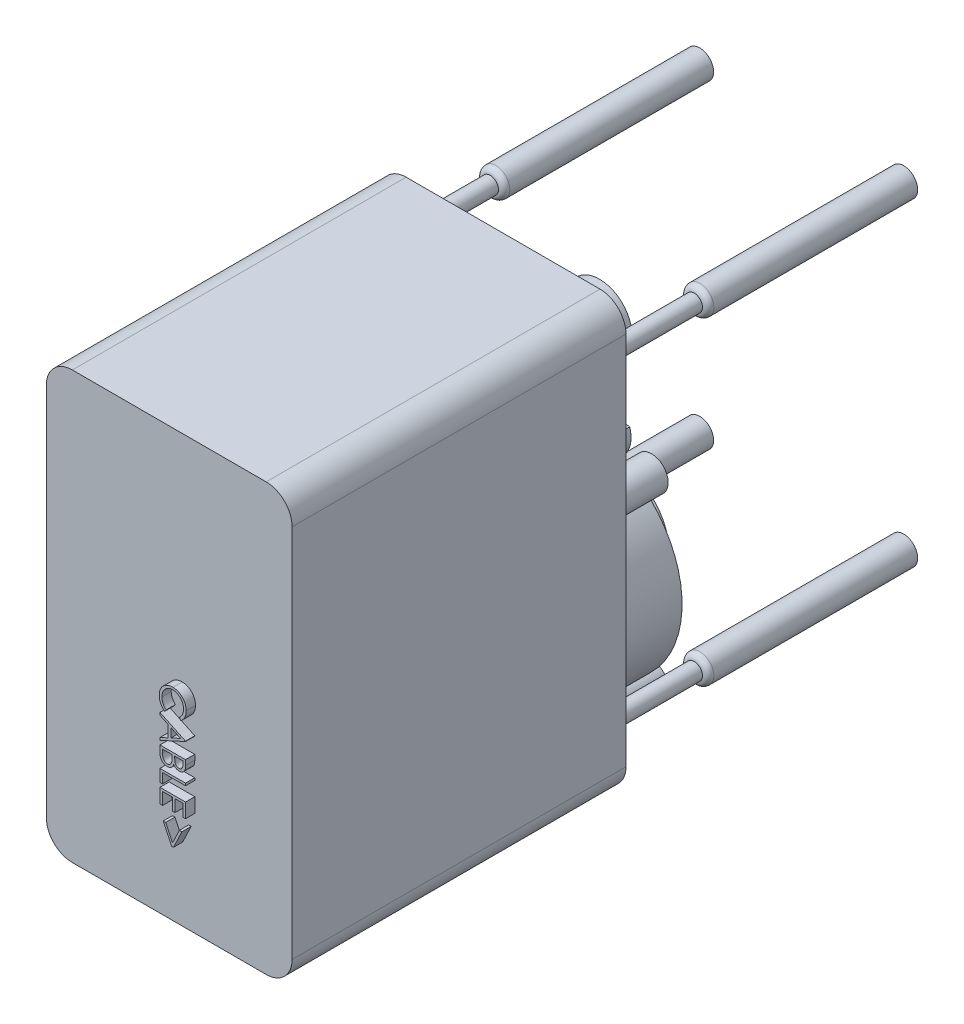
from build123d import *
from build123d.topology import SkipClean

# Parameters (mm, degrees)
SKETCH1_R                = 7.239
BOSS_EXTRUDE1_DEPTH      = 10.16
SKETCH2_R                = 6.35
BOSS_EXTRUDE2_DEPTH      = 1.778
SKETCH3_R                = 2.286
BOSS_EXTRUDE3_DEPTH      = 1.27
BOSS_EXTRUDE4_DEPTH      = 3.556
SKETCH5_R                = 4.445
BOSS_EXTRUDE5_DEPTH      = 11.43
SKETCH6_R                = 1.143
BOSS_EXTRUDE6_DEPTH      = 15.494
BOSS_EXTRUDE6_2_DEPTH    = 15.494
BOSS_EXTRUDE6_3_DEPTH    = 15.494
BOSS_EXTRUDE6_4_DEPTH    = 15.494
SKETCH7_R                = 7.239
BOSS_EXTRUDE7_DEPTH      = 5.334
BOSS_EXTRUDE8_DEPTH      = 45.72
BOSS_EXTRUDE9_DEPTH      = 25.4
BOSS_EXTRUDE9_DEPTH_BACK = 3.302
SKETCH9_R                = 1.905
BOSS_EXTRUDE10_DEPTH     = 1.27
FILLET1_R                = 0.79375


with BuildPart() as part:
    # Sketch1 → Boss-Extrude1 (new body)
    # profile 1 of 7: a face of its own
    with BuildSketch(Plane.XY):
        with BuildLine():
            ThreePointArc((10.064128852, -22.930567504), (13.235964532, -18.24620987), (14.351, -12.7))
            ThreePointArc((14.351, -12.7), (13.235964532, -7.15379013), (10.064128852, -2.469432496))
            ThreePointArc((10.064128852, -2.469432496), (8.455209632, -1.104283934), (6.663505747, 0.010188518))
            ThreePointArc((6.663505747, 0.010188518), (5.175517983, 0.685261096), (3.62043784, 1.186815))
            ThreePointArc((3.62043784, 1.186815), (0, -3.81), (-3.62043784, 1.186815))
            ThreePointArc((-3.62043784, 1.186815), (-5.175517983, 0.685261096), (-6.663505747, 0.010188518))
            ThreePointArc((-6.663505747, 0.010188518), (-8.455209632, -1.104283934), (-10.064128852, -2.469432496))
            ThreePointArc((-10.064128852, -2.469432496), (-14.351, -12.7), (-10.064128852, -22.930567504))
            ThreePointArc((-10.064128852, -22.930567504), (-8.455209632, -24.295716066), (-6.663505747, -25.410188518))
            ThreePointArc((-6.663505747, -25.410188518), (0, -27.051), (6.663505747, -25.410188518))
            ThreePointArc((6.663505747, -25.410188518), (8.455209632, -24.295716066), (10.064128852, -22.930567504))
        make_face()
        with Locations((0, -12.7)):
            Circle(SKETCH1_R, mode=Mode.SUBTRACT)
    # profile 2 of 7: a face of its own
    with BuildSketch(Plane.XY):
        with BuildLine():
            ThreePointArc((-10.064128852, -2.469432496), (-8.455209632, -1.104283934), (-6.663505747, 0.010188518))
            ThreePointArc((-6.663505747, 0.010188518), (-10.236847552, 1.339105214), (-10.064128852, -2.469432496))
        make_face()
    # profile 3 of 7: a face of its own
    with BuildSketch(Plane.XY):
        with BuildLine():
            ThreePointArc((-3.62043784, 1.186815), (0, -3.81), (3.62043784, 1.186815))
            ThreePointArc((3.62043784, 1.186815), (0, 1.651), (-3.62043784, 1.186815))
        make_face()
    # profile 4 of 7: a face of its own
    with BuildSketch(Plane.XY):
        with BuildLine():
            ThreePointArc((6.663505747, 0.010188518), (8.455209632, -1.104283934), (10.064128852, -2.469432496))
            ThreePointArc((10.064128852, -2.469432496), (10.236847552, 1.339105214), (6.663505747, 0.010188518))
        make_face()
    # profile 5 of 7: a face of its own
    with BuildSketch(Plane.XY):
        with BuildLine():
            ThreePointArc((6.663505747, -25.410188518), (10.236847552, -26.739105214), (10.064128852, -22.930567504))
            ThreePointArc((10.064128852, -22.930567504), (8.455209632, -24.295716066), (6.663505747, -25.410188518))
        make_face()
    # profile 6 of 7: a face of its own
    with BuildSketch(Plane.XY):
        with BuildLine():
            ThreePointArc((-10.064128852, -22.930567504), (-10.236847552, -26.739105214), (-6.663505747, -25.410188518))
            ThreePointArc((-6.663505747, -25.410188518), (-8.455209632, -24.295716066), (-10.064128852, -22.930567504))
        make_face()
    # profile 7 of 7: a face of its own
    with BuildSketch(Plane.XY):
        with Locations((0, -12.7)):
            Circle(SKETCH1_R)
    extrude(amount=-BOSS_EXTRUDE1_DEPTH)

    # Sketch3 → Boss-Extrude3 (add)
    with SkipClean():  # the faces are left unmerged after this step: merging them gives an invalid solid
        with BuildSketch(Plane(origin=(0, 0, -10.16), x_dir=(-1, 0, 0), z_dir=(0, 0, -1))):
            with Locations(Location((-8.89, -0.508, 0), (0, 0, 239.094930529))):
                Circle(SKETCH3_R)
            with Locations(Location((8.89, -24.892, 0), (0, 0, 193.101637405))):
                Circle(SKETCH3_R)
            with Locations(Location((-8.89, -24.892, 0), (0, 0, 120.905069471))):
                Circle(SKETCH3_R)
            with Locations(Location((8.89, -0.508, 0), (0, 0, 166.898362595))):
                Circle(SKETCH3_R)
        extrude(amount=BOSS_EXTRUDE3_DEPTH)

    # Sketch4 → Boss-Extrude4 (add)
    with SkipClean():  # the faces are left unmerged after this step: merging them gives an invalid solid
        with BuildSketch(Plane(origin=(0, 0, -10.16), x_dir=(-1, 0, 0), z_dir=(0, 0, -1))):
            with BuildLine():
                ThreePointArc((-3.62043784, 1.186815), (0, -3.81), (3.62043784, 1.186815))
                ThreePointArc((3.62043784, 1.186815), (0, 1.651), (-3.62043784, 1.186815))
            make_face()
        extrude(amount=BOSS_EXTRUDE4_DEPTH)

    # Sketch7 → Boss-Extrude7 (add)
    with SkipClean():  # the faces are left unmerged after this step: merging them gives an invalid solid
        with BuildSketch(Plane(origin=(0, 0, -10.16), x_dir=(-1, 0, 0), z_dir=(0, 0, -1))):
            with Locations(Location((0, -12.7, 0), (0, 0, 180))):
                Circle(SKETCH7_R)
        extrude(amount=BOSS_EXTRUDE7_DEPTH)



with BuildPart() as body_2:
    # Sketch2 → Boss-Extrude2 (new body)
    with BuildSketch(Plane.XY):
        with Locations((0, 14.605)):
            Circle(SKETCH2_R)
    extrude(amount=-BOSS_EXTRUDE2_DEPTH)

    # Sketch5 → Boss-Extrude5 (add)
    with BuildSketch(Plane(origin=(0, 0, -1.778), x_dir=(-1, 0, 0), z_dir=(0, 0, -1))):
        with Locations(Location((0, 12.7, 0), (0, 0, 269.999298311))):
            Circle(SKETCH5_R)
    extrude(amount=BOSS_EXTRUDE5_DEPTH)


with BuildPart() as body_3:
    # Sketch6 → Boss-Extrude6 (new body)
    with BuildSketch(Plane.XY):
        with Locations((-13.97, 21.844)):
            Circle(SKETCH6_R)
    extrude(amount=-BOSS_EXTRUDE6_DEPTH)


with BuildPart() as body_4:
    # Sketch6 → Boss-Extrude6 2 (new body)
    with BuildSketch(Plane.XY):
        with Locations((13.97, 21.844)):
            Circle(SKETCH6_R)
    extrude(amount=-BOSS_EXTRUDE6_2_DEPTH)


with BuildPart() as body_5:
    # Sketch6 → Boss-Extrude6 3 (new body)
    with BuildSketch(Plane.XY):
        with Locations((-13.97, -21.844)):
            Circle(SKETCH6_R)
    extrude(amount=-BOSS_EXTRUDE6_3_DEPTH)


with BuildPart() as body_6:
    # Sketch6 → Boss-Extrude6 4 (new body)
    with BuildSketch(Plane.XY):
        with Locations((13.97, -21.844)):
            Circle(SKETCH6_R)
    extrude(amount=-BOSS_EXTRUDE6_4_DEPTH)


with BuildPart() as part_1:
    with SkipClean():  # the faces are left unmerged after this step: merging them gives an invalid solid
        add(part.part)

        add(body_2.part)  # Boss-Extrude8 merges body 2

        add(body_3.part)  # Boss-Extrude8 merges body 3

        add(body_4.part)  # Boss-Extrude8 merges body 4

        add(body_5.part)  # Boss-Extrude8 merges body 5

        add(body_6.part)  # Boss-Extrude8 merges body 6
        # Sketch8 → Boss-Extrude8 (add)
        with BuildSketch(Plane.XY):
            with BuildLine():
                Line((-13.2715, 29.21), (13.2715, 29.21))
                ThreePointArc((13.2715, 29.21), (15.785971714, 28.168471714), (16.8275, 25.654))
                Line((16.8275, 25.654), (16.8275, -25.654))
                ThreePointArc((16.8275, -25.654), (15.785971714, -28.168471714), (13.2715, -29.21))
                Line((13.2715, -29.21), (-13.2715, -29.21))
                ThreePointArc((-13.2715, -29.21), (-15.785971714, -28.168471714), (-16.8275, -25.654))
                Line((-16.8275, -25.654), (-16.8275, 25.654))
                ThreePointArc((-16.8275, 25.654), (-15.785971714, 28.168471714), (-13.2715, 29.21))
            make_face()
        extrude(amount=BOSS_EXTRUDE8_DEPTH)

    # Sketch9 → Boss-Extrude9 (add, two sides: drawn at the far end of the back side and taken through both)
    with SkipClean():  # the faces are left unmerged after this step: merging them gives an invalid solid
        with BuildSketch(Plane(origin=(0, 0, -15.494), x_dir=(-1, 0, 0), z_dir=(0, 0, -1)).offset(-BOSS_EXTRUDE9_DEPTH_BACK)):
            with Locations((-13.97, 21.844)):
                Circle(SKETCH9_R)
            with Locations((13.97, 21.844)):
                Circle(SKETCH9_R)
            with Locations((13.97, -21.844)):
                Circle(SKETCH9_R)
            with Locations((-13.97, -21.844)):
                Circle(SKETCH9_R)
        extrude(amount=BOSS_EXTRUDE9_DEPTH + BOSS_EXTRUDE9_DEPTH_BACK)

    # Sketch10 → Boss-Extrude10 (add)
    # profile 1 of 6: a face of its own
    with SkipClean():  # the faces are left unmerged after this step: merging them gives an invalid solid
        with BuildSketch(Plane.XY.offset(45.72)):
            with BuildLine():
                Line((2.857772436, -3.679487179), (2.647435897, -3.404647436))
                add(Edge.make_bspline(
                    [(2.647435897, -3.404647436), (2.670801867, -3.385041548), (2.717218783, -3.346094101), (2.782398327, -3.283434898), (2.843463589, -3.218133255), (2.900705469, -3.150214134), (2.952122234, -3.078455015), (3.000393337, -3.004594216), (3.043661075, -2.927396171), (3.096124061, -2.820644436), (3.150870216, -2.680996588), (3.196773448, -2.505201749), (3.225994623, -2.32169065), (3.229159465, -2.196493051), (3.230769231, -2.1328125)],
                    knots=[0, 0, 0, 0, 0.757959112, 1.505699292, 2.245454638, 2.979532153, 3.711538275, 4.438200793, 5.171680507, 5.909471876, 7.393775596, 8.890124382, 10.418191784, 12, 12, 12, 12], degree=3))
                add(Edge.make_bspline(
                    [(3.230769231, -2.1328125), (3.230363445, -2.097729627), (3.229555641, -2.027889483), (3.218973416, -1.924234716), (3.20392868, -1.822319184), (3.1821483, -1.722521872), (3.153792222, -1.625040935), (3.120538112, -1.529134135), (3.079156746, -1.435930999), (3.033456552, -1.34430985), (2.981823731, -1.256534692), (2.925523467, -1.173466714), (2.865108338, -1.095485416), (2.800734294, -1.02237471), (2.731601295, -0.954936411), (2.658522608, -0.892089722), (2.580618642, -0.834967287), (2.499350418, -0.782165421), (2.41459849, -0.735181205), (2.326896016, -0.694608059), (2.236578315, -0.6598335), (2.143460367, -0.632062149), (2.047908611, -0.610157149), (1.949720267, -0.59502418), (1.849085923, -0.584537152), (1.780876701, -0.583736779), (1.746494391, -0.583333333)],
                    knots=[0, 0, 0, 0, 1.055000685, 2.100209969, 3.131349012, 4.153242145, 5.170189196, 6.184191144, 7.204341339, 8.235672124, 9.263040994, 10.265373269, 11.252624173, 12.22887325, 13.193405896, 14.155809299, 15.126090485, 16.097288279, 17.069732292, 18.038585918, 19.002221264, 19.978698174, 20.959418239, 21.948869816, 22.966084182, 24, 24, 24, 24], degree=3))
                add(Edge.make_bspline(
                    [(1.746494391, -0.583333333), (1.694763071, -0.584595152), (1.593195486, -0.587072567), (1.444424876, -0.609120901), (1.301904202, -0.642625992), (1.16652436, -0.692841569), (1.036616002, -0.75476062), (0.914377148, -0.833001231), (0.797960584, -0.923617768), (0.690117636, -1.027892188), (0.591603911, -1.142298004), (0.504853329, -1.265045915), (0.432538447, -1.395830203), (0.3723625, -1.533206833), (0.326105772, -1.678232947), (0.293541649, -1.83064775), (0.272299468, -1.990119745), (0.27026578, -2.099089145), (0.269230769, -2.154547276)],
                    knots=[0, 0, 0, 0, 1.029171465, 2.020641659, 2.987623507, 3.938342917, 4.889210282, 5.84687017, 6.821220943, 7.821438502, 8.827599549, 9.822697543, 10.807740252, 11.797342354, 12.80366471, 13.83203677, 14.896651826, 16, 16, 16, 16], degree=3))
                add(Edge.make_bspline(
                    [(0.269230769, -2.154547276), (0.270919549, -2.215649965), (0.274243472, -2.335914674), (0.302402721, -2.5122827), (0.348060638, -2.681118466), (0.411958561, -2.842431052), (0.495023849, -2.995765698), (0.595721726, -3.141362359), (0.715010059, -3.279343929), (0.806093187, -3.362315211), (0.852564103, -3.404647436)],
                    knots=[0, 0, 0, 0, 1.028121516, 2.023589091, 2.998037872, 3.967518031, 4.937445131, 5.927275754, 6.942489185, 8, 8, 8, 8], degree=3))
                Line((0.852564103, -3.404647436), (0.644330929, -3.679487179))
                add(Edge.make_bspline(
                    [(0.644330929, -3.679487179), (0.615792429, -3.657369099), (0.558852125, -3.613238882), (0.478581139, -3.54178043), (0.403074401, -3.466504759), (0.332956835, -3.386842997), (0.266764666, -3.303747898), (0.206716932, -3.215755784), (0.150984484, -3.12438645), (0.100628049, -3.02910793), (0.05547798, -2.930233036), (0.017361042, -2.827864665), (-0.015946051, -2.722870088), (-0.04316627, -2.615196429), (-0.064445988, -2.50448398), (-0.078663293, -2.391112597), (-0.088405847, -2.274842967), (-0.089293675, -2.196401513), (-0.08974359, -2.156650641)],
                    knots=[0, 0, 0, 0, 0.986756325, 1.968786143, 2.935506311, 3.899499537, 4.868307269, 5.8376204, 6.809456583, 7.792545619, 8.781780509, 9.778496008, 10.776623214, 11.79151764, 12.812666265, 13.856269958, 14.913646641, 16, 16, 16, 16], degree=3))
                add(Edge.make_bspline(
                    [(-0.08974359, -2.156650641), (-0.089481597, -2.119006974), (-0.088963539, -2.044571284), (-0.080571372, -1.934672532), (-0.069121635, -1.827682951), (-0.051881504, -1.723908326), (-0.031537164, -1.622782351), (-0.004265907, -1.525221766), (0.026283259, -1.430266556), (0.062188246, -1.338298215), (0.102704429, -1.249238515), (0.148495987, -1.163374704), (0.199177852, -1.080746271), (0.253632863, -1.000540851), (0.313610164, -0.923943267), (0.378276799, -0.850289742), (0.44741481, -0.779167265), (0.497269663, -0.73516458), (0.522335737, -0.713040865)],
                    knots=[0, 0, 0, 0, 1.114604814, 2.203992996, 3.262667896, 4.300477797, 5.318619304, 6.316056647, 7.298880507, 8.271930387, 9.238335007, 10.195173496, 11.151986948, 12.108099108, 13.064862484, 14.031167946, 15.010108607, 16, 16, 16, 16], degree=3))
                add(Edge.make_bspline(
                    [(0.522335737, -0.713040865), (0.565876926, -0.677605222), (0.652433637, -0.607161745), (0.792719618, -0.517036062), (0.939187827, -0.439888506), (1.092607755, -0.377512586), (1.252635143, -0.328749852), (1.419350657, -0.294968657), (1.592598599, -0.273017053), (1.710435388, -0.270506764), (1.770332532, -0.269230769)],
                    knots=[0, 0, 0, 0, 0.994628077, 1.977248131, 2.950237994, 3.925870899, 4.908910175, 5.911660606, 6.938484602, 8, 8, 8, 8], degree=3))
                add(Edge.make_bspline(
                    [(1.770332532, -0.269230769), (1.833285352, -0.270792919), (1.957141094, -0.27386635), (2.138952641, -0.299762866), (2.312890308, -0.341927395), (2.479623367, -0.399988234), (2.638197835, -0.476586004), (2.789283438, -0.569313798), (2.93275681, -0.679077345), (3.066783632, -0.804498118), (3.18931972, -0.9420727), (3.297126777, -1.089389619), (3.386844068, -1.246172066), (3.461840291, -1.410689784), (3.519484737, -1.584175502), (3.559837929, -1.766258861), (3.584955044, -1.956597778), (3.588130252, -2.086460203), (3.58974359, -2.15244391)],
                    knots=[0, 0, 0, 0, 1.032901378, 2.032168977, 3.007206631, 3.966850309, 4.924221947, 5.891988639, 6.871730993, 7.884084801, 8.900290346, 9.89161143, 10.874607481, 11.860025555, 12.854717796, 13.869097222, 14.917278314, 16, 16, 16, 16], degree=3))
                add(Edge.make_bspline(
                    [(3.58974359, -2.15244391), (3.589261812, -2.192658461), (3.588308181, -2.272259114), (3.578996816, -2.390010625), (3.563502411, -2.50465715), (3.542274027, -2.616475949), (3.516255146, -2.725872498), (3.482194419, -2.83172447), (3.442641565, -2.934608269), (3.39824916, -3.03460095), (3.347498469, -3.130614623), (3.292377899, -3.222631813), (3.231615083, -3.309542503), (3.167218841, -3.392981488), (3.096780331, -3.471070292), (3.022593437, -3.546039113), (2.942456775, -3.615298244), (2.886052222, -3.658051701), (2.857772436, -3.679487179)],
                    knots=[0, 0, 0, 0, 1.096705196, 2.170817488, 3.219277236, 4.250701065, 5.274195539, 6.284202015, 7.28098643, 8.279664616, 9.266225751, 10.241373748, 11.203306326, 12.157093976, 13.114198862, 14.069774147, 15.032234603, 16, 16, 16, 16], degree=3))
            make_face()
        # profile 2 of 6: a face of its own
        with BuildSketch(Plane.XY.offset(45.72)):
            Polygon((3.5, -5.833333333), (0, -7.448717949), (0, -7.107271635), (1.121794872, -6.58984375), (1.121794872, -5.003205128), (0, -4.471053686), (0, -4.128205128), (3.5, -5.788461538), align=None)
            Polygon((2.817808494, -5.807391827), (1.480769231, -5.173577724), (1.480769231, -6.424379006), align=None, mode=Mode.SUBTRACT)
        # profile 3 of 6: a face of its own
        with BuildSketch(Plane.XY.offset(45.72)):
            with BuildLine():
                Line((3.5, -7.987179487), (3.5, -8.670072115))
                add(Edge.make_bspline(
                    [(3.5, -8.670072115), (3.49982425, -8.703500594), (3.499483602, -8.768293304), (3.49420047, -8.862512746), (3.486996801, -8.950761556), (3.475566708, -9.033065329), (3.461774931, -9.109386031), (3.445073115, -9.179953668), (3.425046501, -9.244543841), (3.39320022, -9.321656577), (3.345877051, -9.409577238), (3.275948486, -9.504775631), (3.190416023, -9.58617987), (3.093933368, -9.656366187), (2.987797596, -9.712167307), (2.874538407, -9.752536604), (2.755616665, -9.778094479), (2.673973487, -9.780722914), (2.63271234, -9.782051282)],
                    knots=[0, 0, 0, 0, 1.001505555, 1.941167018, 2.826882275, 3.653841531, 4.429895133, 5.150066043, 5.825578002, 6.45369114, 7.647487171, 8.808567382, 9.977351308, 11.170798116, 12.373658725, 13.556498008, 14.765093433, 16, 16, 16, 16], degree=3))
                add(Edge.make_bspline(
                    [(2.63271234, -9.782051282), (2.594053235, -9.780979192), (2.518084448, -9.778872435), (2.407150679, -9.758040783), (2.301116128, -9.727025424), (2.201287981, -9.682000287), (2.108949247, -9.624084028), (2.02464869, -9.554388494), (1.950429264, -9.471406851), (1.909109541, -9.409135189), (1.888120994, -9.377504006)],
                    knots=[0, 0, 0, 0, 1.044266239, 2.052081639, 3.041743201, 4.026043445, 5.00270663, 5.980942822, 6.97441044, 8, 8, 8, 8], degree=3))
                add(Edge.make_bspline(
                    [(1.888120994, -9.377504006), (1.872867775, -9.417271093), (1.843684588, -9.49335538), (1.791808319, -9.598132695), (1.736021049, -9.688767398), (1.674776106, -9.76535925), (1.607935032, -9.829876034), (1.536836284, -9.887813444), (1.45797957, -9.936352004), (1.37361028, -9.978050718), (1.284320561, -10.010867169), (1.190518767, -10.034086961), (1.093253774, -10.048354394), (1.026957798, -10.050299901), (0.993489583, -10.051282051)],
                    knots=[0, 0, 0, 0, 1.272302504, 2.434229863, 3.488457646, 4.447234501, 5.35599188, 6.26022912, 7.18267843, 8.11661068, 9.06895546, 10.019249207, 11.000057067, 12, 12, 12, 12], degree=3))
                add(Edge.make_bspline(
                    [(0.993489583, -10.051282051), (0.959322905, -10.050304899), (0.892099008, -10.048382324), (0.793341106, -10.034206731), (0.698976329, -10.010181531), (0.60833373, -9.977169594), (0.521926377, -9.933840061), (0.438672091, -9.882245878), (0.36078871, -9.819449219), (0.286424081, -9.749453453), (0.219600708, -9.670175718), (0.160109352, -9.584653658), (0.110959363, -9.491657184), (0.070188246, -9.392628424), (0.038590839, -9.286909331), (0.016654453, -9.174891884), (0.001839273, -9.056551741), (0.000623494, -8.975341406), (0, -8.93369391)],
                    knots=[0, 0, 0, 0, 0.978404568, 1.925038397, 2.85041836, 3.763147166, 4.682162379, 5.614488577, 6.562659439, 7.54271123, 8.535210642, 9.526693784, 10.520907202, 11.541451354, 12.589717429, 13.675358278, 14.807842563, 16, 16, 16, 16], degree=3))
                Line((0, -8.93369391), (0, -7.987179487))
                Line((0, -7.987179487), (3.5, -7.987179487))
            make_face()
            with BuildLine():
                Line((3.141025641, -8.301282051), (2.019230769, -8.301282051))
                Line((2.019230769, -8.301282051), (2.019230769, -8.512319712))
                add(Edge.make_bspline(
                    [(2.019230769, -8.512319712), (2.019627364, -8.543168785), (2.020393667, -8.602775481), (2.022657945, -8.689324772), (2.028720383, -8.769462091), (2.035132411, -8.843463576), (2.045005621, -8.910833237), (2.057087658, -8.97179661), (2.069753809, -9.026901337), (2.091355012, -9.090420305), (2.122955643, -9.162449973), (2.173150423, -9.238748286), (2.231312009, -9.307103551), (2.299660574, -9.364179334), (2.374282065, -9.411276833), (2.455183134, -9.44270766), (2.539205431, -9.465001132), (2.597038901, -9.466956125), (2.626402244, -9.467948718)],
                    knots=[0, 0, 0, 0, 1.156481963, 2.23455883, 3.244418989, 4.168404366, 5.01828131, 5.794834307, 6.498111525, 7.13526334, 8.307595709, 9.435046769, 10.546766856, 11.659452936, 12.760769924, 13.837671619, 14.902137667, 16, 16, 16, 16], degree=3))
                add(Edge.make_bspline(
                    [(2.626402244, -9.467948718), (2.645837164, -9.46745228), (2.683960884, -9.466478463), (2.739322416, -9.457615573), (2.792056229, -9.444755433), (2.84094948, -9.424663971), (2.887391857, -9.40036924), (2.929320542, -9.368766205), (2.969032638, -9.333075662), (3.005070015, -9.291160594), (3.037359647, -9.243223955), (3.06577169, -9.188808998), (3.088183923, -9.12726598), (3.108288888, -9.059990319), (3.122239543, -8.985905328), (3.133904149, -8.905734918), (3.13983359, -8.81879898), (3.140619428, -8.758654053), (3.141025641, -8.727564103)],
                    knots=[0, 0, 0, 0, 0.911752476, 1.788502045, 2.626783689, 3.45400582, 4.26402138, 5.080402872, 5.911472738, 6.767166405, 7.66795952, 8.620018292, 9.640966946, 10.73819047, 11.913090943, 13.176185384, 14.540321519, 16, 16, 16, 16], degree=3))
                Line((3.141025641, -8.727564103), (3.141025641, -8.301282051))
            make_face(mode=Mode.SUBTRACT)
            with BuildLine():
                Line((1.66025641, -8.301282051), (0.358974359, -8.301282051))
                Line((0.358974359, -8.301282051), (0.358974359, -8.748597756))
                add(Edge.make_bspline(
                    [(0.358974359, -8.748597756), (0.359356766, -8.780616841), (0.360093805, -8.842329406), (0.362526199, -8.931428523), (0.367942779, -9.013786891), (0.376773248, -9.089451901), (0.385948875, -9.159089613), (0.398648387, -9.222008173), (0.413086196, -9.278304041), (0.43542939, -9.343572232), (0.470080688, -9.417115598), (0.522667742, -9.496314398), (0.584492161, -9.56743167), (0.656948104, -9.627131057), (0.735135085, -9.676428471), (0.81864416, -9.711003623), (0.904927716, -9.733234951), (0.963909533, -9.735861995), (0.993489583, -9.737179487)],
                    knots=[0, 0, 0, 0, 1.159821618, 2.235403267, 3.228114831, 4.14795534, 4.994323282, 5.771256229, 6.471395042, 7.097801288, 8.267864287, 9.404187171, 10.531774336, 11.667624178, 12.792825787, 13.866573821, 14.930062559, 16, 16, 16, 16], degree=3))
                add(Edge.make_bspline(
                    [(0.993489583, -9.737179487), (1.011985316, -9.736910196), (1.048678445, -9.736375957), (1.102559382, -9.728016016), (1.154984973, -9.716353352), (1.205162465, -9.699464814), (1.253908353, -9.678169735), (1.30037356, -9.651445218), (1.345669087, -9.620583465), (1.402867072, -9.572305486), (1.468791298, -9.502150596), (1.533326389, -9.402438104), (1.585374877, -9.28906742), (1.607474256, -9.206839697), (1.618890224, -9.164362981)],
                    knots=[0, 0, 0, 0, 0.723503378, 1.435336582, 2.130201219, 2.824764462, 3.504949994, 4.209866579, 4.920640069, 5.648298893, 7.13757748, 8.670694625, 10.280166878, 12, 12, 12, 12], degree=3))
                add(Edge.make_bspline(
                    [(1.618890224, -9.164362981), (1.622345541, -9.147333901), (1.629837379, -9.110411343), (1.637740616, -9.050203457), (1.644830077, -8.981237103), (1.64993647, -8.903807058), (1.655418093, -8.81760537), (1.657474037, -8.722659733), (1.659983424, -8.618903025), (1.660163087, -8.546910565), (1.66025641, -8.509515224)],
                    knots=[0, 0, 0, 0, 0.634452549, 1.375623993, 2.216454381, 3.166361212, 4.209414599, 5.370755378, 6.634280627, 8, 8, 8, 8], degree=3))
                Line((1.66025641, -8.509515224), (1.66025641, -8.301282051))
            make_face(mode=Mode.SUBTRACT)
        # profile 4 of 6: a face of its own
        with BuildSketch(Plane.XY.offset(45.72)):
            Polygon((3.5, -10.769230769), (3.5, -11.083333333), (0.358974359, -11.083333333), (0.358974359, -12.429487179), (0, -12.429487179), (0, -10.769230769), align=None)
        # profile 5 of 6: a face of its own
        with BuildSketch(Plane.XY.offset(45.72)):
            Polygon((3.5, -13.012820513), (3.5, -14.987179487), (3.141025641, -14.987179487), (3.141025641, -13.326923077), (2.064102564, -13.326923077), (2.064102564, -14.987179487), (1.705128205, -14.987179487), (1.705128205, -13.326923077), (0.358974359, -13.326923077), (0.358974359, -14.987179487), (0, -14.987179487), (0, -13.012820513), align=None)
        # profile 6 of 6: a face of its own
        with BuildSketch(Plane.XY.offset(45.72)):
            Polygon((0.790164263, -16.782051282), (1.727564103, -18.746594551), (2.664963942, -16.782051282), (3.006410256, -16.782051282), (1.850260417, -19.205128205), (1.604867788, -19.205128205), (0.448717949, -16.782051282), align=None)
        extrude(amount=BOSS_EXTRUDE10_DEPTH)

    # Fillet1
    # the kernel refuses this fillet: 0.79375 mm, written as the material it takes off along each edge
    with BuildSketch(Plane(origin=(13.97, 21.844, -12.192), x_dir=(-1, 0, 0), z_dir=(0, -1, 0))) as fillet1_piece_1_section:
        with BuildLine():
            CenterArc((1.905 - FILLET1_R, FILLET1_R), FILLET1_R, 270, 90)
            Line((1.905, FILLET1_R), (1.905, 0))
            Line((1.905, 0), (1.905 - FILLET1_R, 0))
        make_face()
    fillet1_piece_1 = revolve(axis=Axis((13.97, 21.844, -12.192), (0, 0, -1)), mode=Mode.PRIVATE)
    fillet1_piece_1 = fillet1_piece_1 - Plane(origin=(13.97, 21.844, -12.427494004), x_dir=(1, 0, 0), z_dir=(0, 0, 1)) * Cylinder(1.143, 8, mode=Mode.PRIVATE)
    add(fillet1_piece_1, mode=Mode.SUBTRACT)
    with BuildSketch(Plane(origin=(-13.97, 21.844, -12.192), x_dir=(-1, 0, 0), z_dir=(0, -1, 0))) as fillet1_piece_2_section:
        with BuildLine():
            CenterArc((1.905 - FILLET1_R, FILLET1_R), FILLET1_R, 270, 90)
            Line((1.905, FILLET1_R), (1.905, 0))
            Line((1.905, 0), (1.905 - FILLET1_R, 0))
        make_face()
    fillet1_piece_2 = revolve(axis=Axis((-13.97, 21.844, -12.192), (0, 0, -1)), mode=Mode.PRIVATE)
    fillet1_piece_2 = fillet1_piece_2 - Plane(origin=(-13.97, 21.844, -12.427494004), x_dir=(1, 0, 0), z_dir=(0, 0, 1)) * Cylinder(1.143, 8, mode=Mode.PRIVATE)
    add(fillet1_piece_2, mode=Mode.SUBTRACT)
    with BuildSketch(Plane(origin=(-13.97, -21.844, -12.192), x_dir=(-1, 0, 0), z_dir=(0, -1, 0))) as fillet1_piece_3_section:
        with BuildLine():
            CenterArc((1.905 - FILLET1_R, FILLET1_R), FILLET1_R, 270, 90)
            Line((1.905, FILLET1_R), (1.905, 0))
            Line((1.905, 0), (1.905 - FILLET1_R, 0))
        make_face()
    fillet1_piece_3 = revolve(axis=Axis((-13.97, -21.844, -12.192), (0, 0, -1)), mode=Mode.PRIVATE)
    fillet1_piece_3 = fillet1_piece_3 - Plane(origin=(-13.97, -21.844, -12.427494004), x_dir=(1, 0, 0), z_dir=(0, 0, 1)) * Cylinder(1.143, 8, mode=Mode.PRIVATE)
    add(fillet1_piece_3, mode=Mode.SUBTRACT)
    with BuildSketch(Plane(origin=(13.97, -21.844, -12.192), x_dir=(-1, 0, 0), z_dir=(0, -1, 0))) as fillet1_piece_4_section:
        with BuildLine():
            CenterArc((1.905 - FILLET1_R, FILLET1_R), FILLET1_R, 270, 90)
            Line((1.905, FILLET1_R), (1.905, 0))
            Line((1.905, 0), (1.905 - FILLET1_R, 0))
        make_face()
    fillet1_piece_4 = revolve(axis=Axis((13.97, -21.844, -12.192), (0, 0, -1)), mode=Mode.PRIVATE)
    fillet1_piece_4 = fillet1_piece_4 - Plane(origin=(13.97, -21.844, -12.427494004), x_dir=(1, 0, 0), z_dir=(0, 0, 1)) * Cylinder(1.143, 8, mode=Mode.PRIVATE)
    add(fillet1_piece_4, mode=Mode.SUBTRACT)


solid = part_1.part
